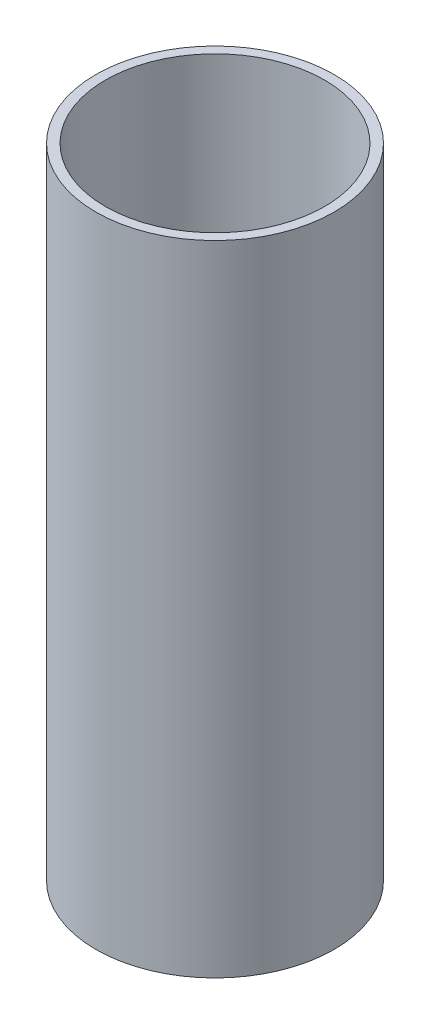
from build123d import *

# Parameters (mm, degrees)
SKETCH1_R           = 12.5
SKETCH1_R_2         = 11.5
BOSS_EXTRUDE1_DEPTH = 67


with BuildPart() as part:
    # Sketch1 → Boss-Extrude1 (new body)
    with BuildSketch(Plane(origin=(0, 0, 0), x_dir=(1, 0, 0), z_dir=(0, 1, 0))):
        Circle(SKETCH1_R)
        Circle(SKETCH1_R_2, mode=Mode.SUBTRACT)
    extrude(amount=BOSS_EXTRUDE1_DEPTH)


solid = part.part
